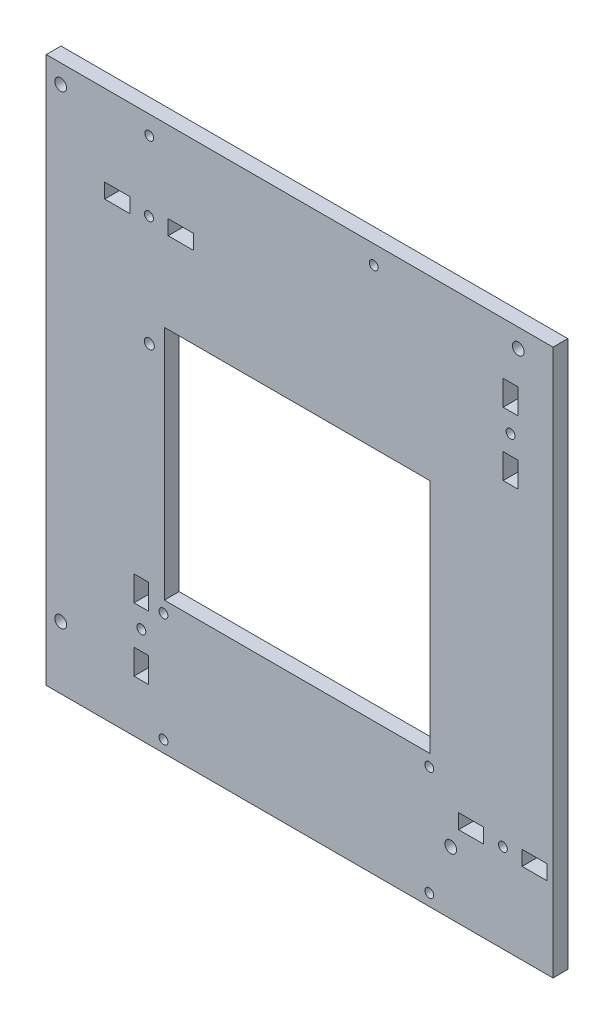
from build123d import *

# Parameters (mm, degrees)
SKETCH2_W               = 189.43
SKETCH2_H               = 185
SKETCH2_R               = 1.98
SKETCH2_R_2             = 1.5
SKETCH2_R_3             = 1.694817964
SKETCH2_W_2             = 2.32
SKETCH2_H_2             = 164.83
SKETCH2_W_3             = 8.5
SKETCH2_H_3             = 5
SKETCH2_W_4             = 90
SKETCH2_H_4             = 80
SKETCH2_W_5             = 5
SKETCH2_H_5             = 8.5
BOSS_EXTRUDE1_DEPTH     = 5
SKETCH3_R               = 1.5
CUT_EXTRUDE1_DEPTH      = 10
CUT_EXTRUDE2_DEPTH      = 145.674202607
CUT_EXTRUDE2_DEPTH_BACK = 145.674202607


with BuildPart() as part:
    # Sketch2 → Boss-Extrude1 (new body)
    with BuildSketch(Plane.XY):
        with Locations((9.715, -7.5)):
            Rectangle(SKETCH2_W, SKETCH2_H)
        with Locations((-80.1, 78.65)):
            Circle(SKETCH2_R, mode=Mode.SUBTRACT)
        with Locations((74.84, 78.65)):
            Circle(SKETCH2_R, mode=Mode.SUBTRACT)
        with Locations((51.98, -78.83)):
            Circle(SKETCH2_R, mode=Mode.SUBTRACT)
        with Locations((-80.1, -78.83)):
            Circle(SKETCH2_R, mode=Mode.SUBTRACT)
        with Locations((25.9, 78.65)):
            Circle(SKETCH2_R_2, mode=Mode.SUBTRACT)
        with Locations((-50.1, 78.65)):
            Circle(SKETCH2_R_2, mode=Mode.SUBTRACT)
        with Locations((-50.1, 17.65)):
            Circle(SKETCH2_R_3, mode=Mode.SUBTRACT)
        with Locations((-50.210927607, 55)):
            Circle(SKETCH2_R_2, mode=Mode.SUBTRACT)
        with Locations((72.215, 52.425927607)):
            Circle(SKETCH2_R_2, mode=Mode.SUBTRACT)
        with Locations((69.640927607, -70)):
            Circle(SKETCH2_R_2, mode=Mode.SUBTRACT)
        with Locations((-52.785, -67.425927607)):
            Circle(SKETCH2_R_2, mode=Mode.SUBTRACT)
        with Locations((87.77, -7.5)):
            Rectangle(SKETCH2_W_2, SKETCH2_H_2, mode=Mode.SUBTRACT)
        with Locations((-60.960927607, 55)):
            Rectangle(SKETCH2_W_3, SKETCH2_H_3, mode=Mode.SUBTRACT)
        with Locations((0, -15)):
            Rectangle(SKETCH2_W_4, SKETCH2_H_4, mode=Mode.SUBTRACT)
        with Locations((-39.460927607, 55)):
            Rectangle(SKETCH2_W_3, SKETCH2_H_3, mode=Mode.SUBTRACT)
        with Locations((72.215, 63.175927607)):
            Rectangle(SKETCH2_W_5, SKETCH2_H_5, mode=Mode.SUBTRACT)
        with Locations((72.215, 41.675927607)):
            Rectangle(SKETCH2_W_5, SKETCH2_H_5, mode=Mode.SUBTRACT)
        with Locations((80.390927607, -70)):
            Rectangle(SKETCH2_W_3, SKETCH2_H_3, mode=Mode.SUBTRACT)
        with Locations((58.890927607, -70)):
            Rectangle(SKETCH2_W_3, SKETCH2_H_3, mode=Mode.SUBTRACT)
        with Locations((-52.785, -78.175927607)):
            Rectangle(SKETCH2_W_5, SKETCH2_H_5, mode=Mode.SUBTRACT)
        with Locations((-52.785, -56.675927607)):
            Rectangle(SKETCH2_W_5, SKETCH2_H_5, mode=Mode.SUBTRACT)
    extrude(amount=BOSS_EXTRUDE1_DEPTH)

    # Sketch3 → Cut-Extrude1 (cut)
    with BuildSketch(Plane(origin=(0, 0, 5), x_dir=(-1, 0, 0), z_dir=(0, 0, 1))):
        with Locations((45.285, 59)):
            Circle(SKETCH3_R)
        with Locations((-44.715, 59)):
            Circle(SKETCH3_R)
        with Locations((-44.715, 96)):
            Circle(SKETCH3_R)
        with Locations((45.285, 96)):
            Circle(SKETCH3_R)
    extrude(amount=-CUT_EXTRUDE1_DEPTH, mode=Mode.SUBTRACT)

    # Sketch4 → Cut-Extrude2 (cut, two sides: drawn at the far end of the back side and taken through both)
    with BuildSketch(Plane.XY.offset(5).offset(-CUT_EXTRUDE2_DEPTH_BACK)):
        Polygon((86.61, 636.514216797), (86.61, 85), (86.61, -124.426406282), (86.61, -675.94062308), (1189.638433594, -675.94062308), (1189.638433594, 636.514216797), align=None)
    extrude(amount=CUT_EXTRUDE2_DEPTH + CUT_EXTRUDE2_DEPTH_BACK, mode=Mode.SUBTRACT)


solid = part.part
